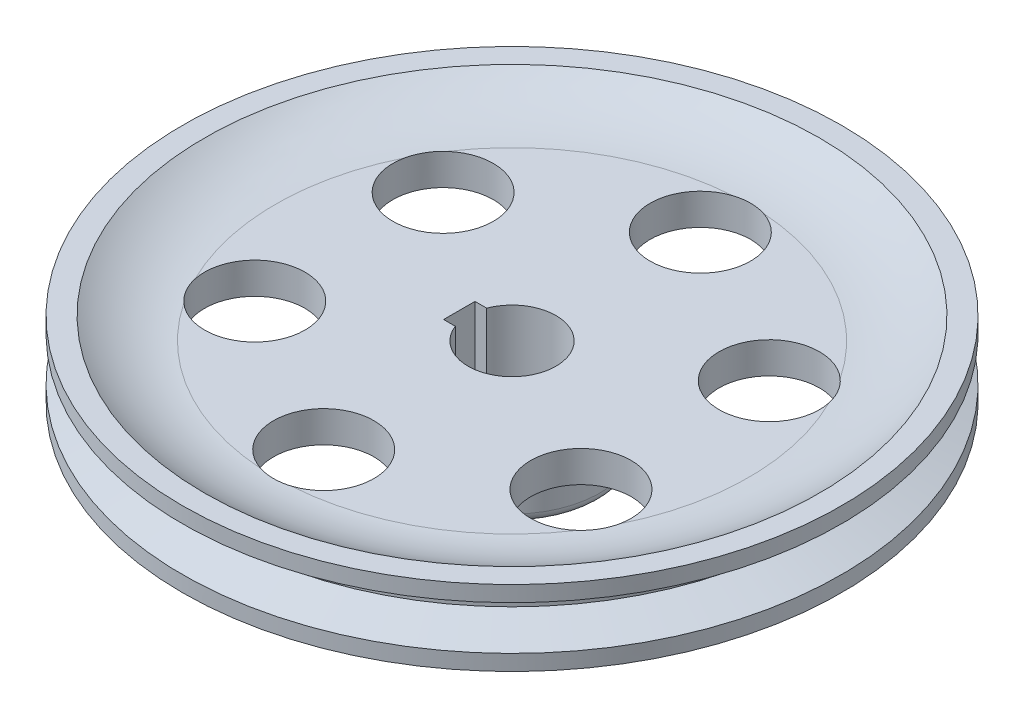
from build123d import *

# Parameters (mm, degrees)
SKETCH1_R               = 52.5
SKETCH1_R_2             = 8
BOSS_EXTRUDE1_DEPTH     = 6
SKETCH2_R               = 14
BOSS_EXTRUDE2_DEPTH     = 7
CUT_EXTRUDE1_DEPTH      = 77
SKETCH4_R               = 49
CUT_EXTRUDE2_DEPTH      = 3.5
CUT_EXTRUDE2_DRAFT      = -40
FILLET1_R               = 20
MIRROR1_COPY_1_SKETCH_R = 49
MIRROR1_COPY_1_DEPTH    = 3.5
MIRROR1_COPY_1_DRAFT    = -40
SKETCH6_R               = 14
BOSS_EXTRUDE3_DEPTH     = 10.5
FILLET2_R               = 1.5
FILLET3_R               = 2


with BuildPart() as part:
    # Sketch1 → Boss-Extrude1 (new, symmetric)
    with BuildSketch(Plane(origin=(0, 0, 0), x_dir=(1, 0, 0), z_dir=(0, 1, 0))):
        with Locations(Location((0, 0, 0), (0, 0, 270))):
            Circle(SKETCH1_R)
        with Locations(Location((0, 30, 0), (0, 0, 270))):
            Circle(SKETCH1_R_2, mode=Mode.SUBTRACT)
        with Locations(Location((25.980762114, 15, 0), (0, 0, 270))):
            Circle(SKETCH1_R_2, mode=Mode.SUBTRACT)
        with Locations(Location((25.980762114, -15, 0), (0, 0, 270))):
            Circle(SKETCH1_R_2, mode=Mode.SUBTRACT)
        with Locations(Location((0, -30, 0), (0, 0, 270))):
            Circle(SKETCH1_R_2, mode=Mode.SUBTRACT)
        with Locations(Location((-25.980762114, -15, 0), (0, 0, 270))):
            Circle(SKETCH1_R_2, mode=Mode.SUBTRACT)
        with Locations(Location((-25.980762114, 15, 0), (0, 0, 270))):
            Circle(SKETCH1_R_2, mode=Mode.SUBTRACT)
    extrude(amount=BOSS_EXTRUDE1_DEPTH, both=True)

    # Sketch2 → Boss-Extrude2 (add)
    with BuildSketch(Plane.XZ.offset(6)):
        with Locations(Location((0, 0, 0), (0, 0, 270))):
            Circle(SKETCH2_R)
    extrude(amount=BOSS_EXTRUDE2_DEPTH)

    # Sketch3 → Cut-Extrude1 (cut)
    with BuildSketch(Plane.XZ.offset(13)):
        with BuildLine():
            Line((-8.4, 2.5), (-8.4, -2.5))
            Line((-8.4, -2.5), (-6.538348415, -2.5))
            ThreePointArc((-6.538348415, -2.5), (7, 0), (-6.538348415, 2.5))
            Line((-6.538348415, 2.5), (-8.4, 2.5))
        make_face()
    extrude(amount=-CUT_EXTRUDE1_DEPTH, mode=Mode.SUBTRACT)


with BuildPart() as cut_extrude2_tool:
    # Sketch4 → Cut-Extrude2 (with draft: the straight prism first)
    with BuildSketch(Plane(origin=(0, 6, 0), x_dir=(1, 0, 0), z_dir=(0, 1, 0))):
        Circle(SKETCH4_R)
    extrude(amount=-CUT_EXTRUDE2_DEPTH)
    # Cut-Extrude2: the draft: its side faces are tilted about the plane it starts from
    cut_extrude2_sides = [cut_extrude2_tool.faces().sort_by_distance(p)[0] for p in [
        (-49, 4.25, 0),
    ]]
    draft(cut_extrude2_sides, Plane(origin=(0, 6, 0), x_dir=(1, 0, 0), z_dir=(0, 1, 0)), CUT_EXTRUDE2_DRAFT)


with BuildPart() as part_1:
    add(part.part)

    # Cut-Extrude2: cut by cut_extrude2_tool
    add(cut_extrude2_tool.part, mode=Mode.SUBTRACT)

    # Fillet1
    # the kernel refuses this fillet: 20 mm, written as the material it adds along each edge
    with BuildSketch(Plane(origin=(0, 2.5, 0), x_dir=(1, 0, 0), z_dir=(0, 0, 1))) as fillet1_piece_1_section:
        with BuildLine():
            CenterArc((37.697345445, 20), FILLET1_R, 270, 34.41150867)
            Line((37.697345445, 0), (37.697345445, -0.4))
            Line((37.697345445, -0.4), (46.063151291, -0.4))
            Line((46.063151291, -0.4), (46.369569068, -0.257115044))
            ThreePointArc((46.369569068, -0.257115044), (47.837993423, 1.492884956), (49.226053091, 3.17))
            Line((49.226053091, 3.17), (49, 3.5))
        make_face()
    fillet1_piece_1 = revolve(axis=Axis((0, 2.5, 0), (0, 1, 0)), mode=Mode.PRIVATE)
    fillet1_piece_1 = fillet1_piece_1 - Plane(origin=(-25.980762114, 3.249062711, 15), x_dir=(0, 0, 1), z_dir=(0, -1, 0)) * Cylinder(8, 197, mode=Mode.PRIVATE)
    fillet1_piece_1 = fillet1_piece_1 - Plane(origin=(0, 3.249062711, 30), x_dir=(0, 0, 1), z_dir=(0, -1, 0)) * Cylinder(8, 197, mode=Mode.PRIVATE)
    fillet1_piece_1 = fillet1_piece_1 - Plane(origin=(25.980762114, 3.249062711, 15), x_dir=(0, 0, 1), z_dir=(0, -1, 0)) * Cylinder(8, 197, mode=Mode.PRIVATE)
    fillet1_piece_1 = fillet1_piece_1 - Plane(origin=(-25.980762114, 3.249062711, -15), x_dir=(0, 0, 1), z_dir=(0, -1, 0)) * Cylinder(8, 197, mode=Mode.PRIVATE)
    fillet1_piece_1 = fillet1_piece_1 - Plane(origin=(0, 3.249062711, -30), x_dir=(0, 0, 1), z_dir=(0, -1, 0)) * Cylinder(8, 197, mode=Mode.PRIVATE)
    fillet1_piece_1 = fillet1_piece_1 - Plane(origin=(25.980762114, 3.249062711, -15), x_dir=(0, 0, 1), z_dir=(0, -1, 0)) * Cylinder(8, 197, mode=Mode.PRIVATE)
    add(fillet1_piece_1)


with BuildPart() as mirror1_copy_1_tool:
    # Mirror1 copy 1 sketch → Mirror1 copy 1 (with draft: the straight prism first)
    with BuildSketch(Plane.XZ.offset(6)):
        Circle(MIRROR1_COPY_1_SKETCH_R)
    extrude(amount=-MIRROR1_COPY_1_DEPTH)
    # Mirror1 copy 1: the draft: its side faces are tilted about the plane it starts from
    mirror1_copy_1_sides = [mirror1_copy_1_tool.faces().sort_by_distance(p)[0] for p in [
        (-49, -4.25, 0),
    ]]
    draft(mirror1_copy_1_sides, Plane.XZ.offset(6), MIRROR1_COPY_1_DRAFT)


with BuildPart() as part_2:
    add(part_1.part)

    # Mirror1 copy 1: cut by mirror1_copy_1_tool
    add(mirror1_copy_1_tool.part, mode=Mode.SUBTRACT)

    # Sketch5 → Cut-Revolve1 (revolve, cut)
    with BuildSketch(Plane.XY, mode=Mode.PRIVATE) as cut_revolve1_sk:
        Polygon((52.5, 3.5), (52.5, -3.5), (46.5, -1.316178594), (46.5, 1.316178594), align=None)
    revolve(cut_revolve1_sk.sketch.rotate(Axis((0, 0, 0), (0, 1, 0)), 90), axis=Axis((0, 0, 0), (0, 1, 0)), mode=Mode.SUBTRACT)

    # Sketch6 → Boss-Extrude3 (add)
    with BuildSketch(Plane.XZ.offset(13)):
        with Locations(Location((0, 0, 0), (0, 0, 270))):
            Circle(SKETCH6_R)
        with BuildLine():
            Line((-8.4, 2.5), (-8.4, -2.5))
            Line((-8.4, -2.5), (-6.538348415, -2.5))
            ThreePointArc((-6.538348415, -2.5), (7, 0), (-6.538348415, 2.5))
            Line((-6.538348415, 2.5), (-8.4, 2.5))
        make_face(mode=Mode.SUBTRACT)
    extrude(amount=-BOSS_EXTRUDE3_DEPTH)

    # Fillet2
    fillet2_edges = [part_2.edges().sort_by_distance(p)[0] for p in [
        (0, -13, 14),
    ]]
    fillet(fillet2_edges, radius=FILLET2_R)

    # Fillet3
    fillet3_edges = [part_2.edges().sort_by_distance(p)[0] for p in [
        (0, -2.5, 14),
    ]]
    fillet(fillet3_edges, radius=FILLET3_R)


solid = part_2.part
